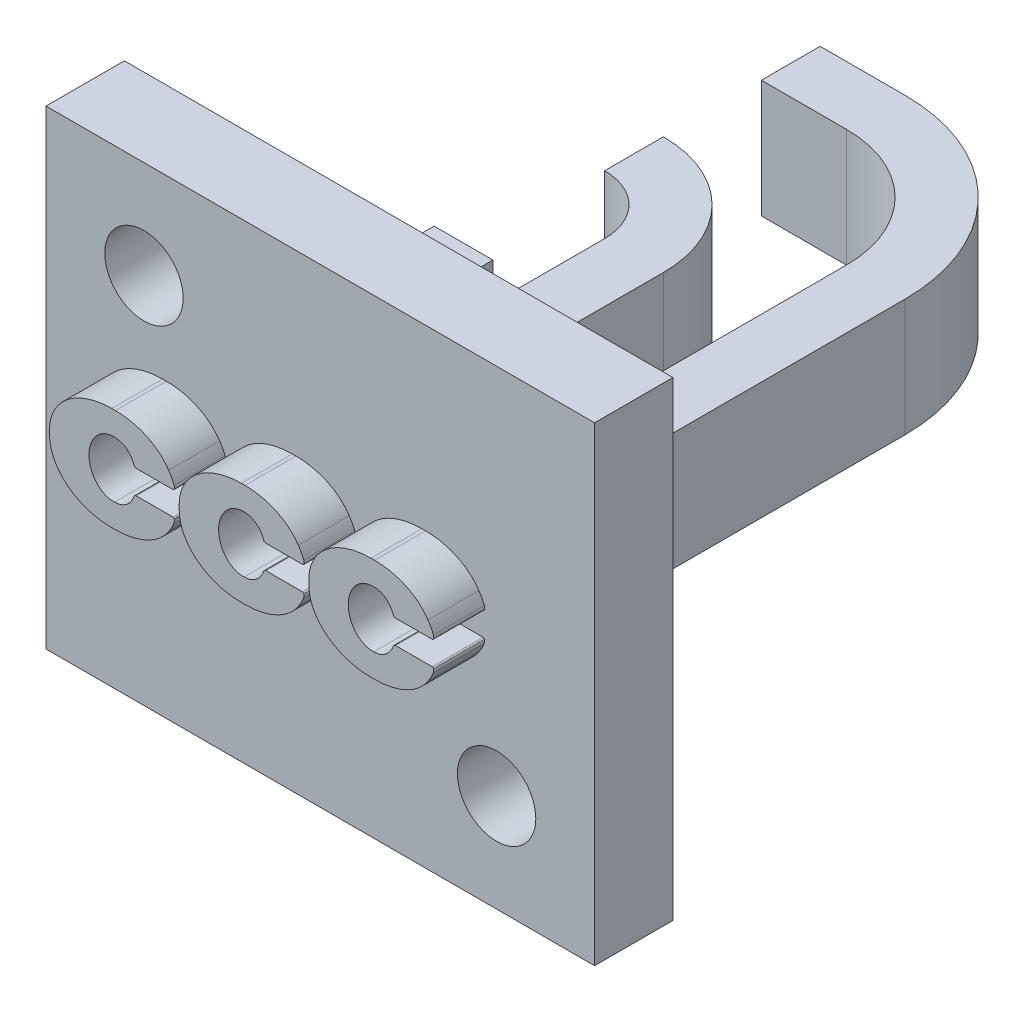
from build123d import *

# Parameters (mm, degrees)
SKETCH1_W           = 15
SKETCH1_H           = 12
BOSS_EXTRUDE1_DEPTH = 2
BOSS_EXTRUDE2_DEPTH = 2
SKETCH3_W           = 1.5
SKETCH3_H           = 4.8
BOSS_EXTRUDE3_DEPTH = 1.5
FILLET3_R           = 1.5
FILLET4_R           = 3
FILLET5_R           = 3
FILLET6_R           = 4.5
SKETCH4_W           = 2
SKETCH4_H           = 12
CUT_EXTRUDE1_DEPTH  = 1
SKETCH5_R           = 1
CUT_EXTRUDE2_DEPTH  = 17.731407672
CUT_EXTRUDE3_START  = -0.7
CUT_EXTRUDE3_DEPTH  = 0.7


with BuildPart() as part:
    # Sketch1 → Boss-Extrude1 (new body)
    with BuildSketch(Plane.XY):
        Rectangle(SKETCH1_W, SKETCH1_H)
    extrude(amount=BOSS_EXTRUDE1_DEPTH)

    # Sketch2 → Boss-Extrude2 (add)
    with BuildSketch(Plane.XY.offset(2)):
        with BuildLine():
            Line((-0.583484164, 0.443787032), (0.352350759, 0.443787032))
            ThreePointArc((0.352350759, 0.443787032), (0.370660979, 0.451874829), (0.381594807, 0.468641703))
            ThreePointArc((0.381594807, 0.468641703), (0.38478126, 0.512633483), (0.377406248, 0.556119567))
            ThreePointArc((0.377406248, 0.556119567), (0.316958398, 0.689104808), (0.240244136, 0.81341868))
            add(Edge.make_bspline(
                [(0.240244136, 0.81341868), (-0.178053426, 1.454553053), (-1.120854898, 1.454553053)],
                knots=[3.484341046, 3.484341046, 3.484341046, 4.522924348, 4.522924348, 4.522924348], degree=2, weights=[1, 0.868170926, 1]))
            Line((-1.120854898, 1.454553053), (-1.214475951, 1.454553068))
            add(Edge.make_bspline(
                [(-1.214475951, 1.454553068), (-2.800132813, 1.454553068), (-2.800132813, 0.203397992)],
                knots=[1.670440536, 1.670440536, 1.670440536, 3.203377674, 3.203377674, 3.203377674], degree=2, weights=[1, 0.720364542, 1]))
            Line((-2.800132813, 0.203397992), (-2.800132806, 0.073267738))
            add(Edge.make_bspline(
                [(-2.800132806, 0.073267738), (-2.800132806, -1.177887338), (-1.214475944, -1.177887338)],
                knots=[3.079807634, 3.079807634, 3.079807634, 4.612744771, 4.612744771, 4.612744771], degree=2, weights=[1, 0.720364542, 1]))
            Line((-1.214475944, -1.177887338), (-1.120854891, -1.177887375))
            add(Edge.make_bspline(
                [(-1.120854891, -1.177887375), (-0.178053419, -1.177887375), (0.240244143, -0.536753002)],
                knots=[1.760260959, 1.760260959, 1.760260959, 2.798844261, 2.798844261, 2.798844261], degree=2, weights=[1, 0.868170926, 1]))
            ThreePointArc((0.240244143, -0.536753002), (0.313994237, -0.417650167), (0.372658208, -0.290437354))
            ThreePointArc((0.372658208, -0.290437354), (0.384251196, -0.24211404), (0.382489087, -0.192450825))
            ThreePointArc((0.382489087, -0.192450825), (0.370484527, -0.171527836), (0.347824512, -0.163257123))
            Line((0.347824512, -0.163257123), (-0.58348421, -0.163257123))
            ThreePointArc((-0.58348421, -0.163257123), (-0.62125204, -0.175257922), (-0.645165579, -0.206858093))
            add(Edge.make_bspline(
                [(-1.141657158, -0.577741646), (-0.776549247, -0.578100851), (-0.645165579, -0.206858093)],
                knots=[5.955155363, 5.955155363, 5.955155363, 7.020735545, 7.020735545, 7.020735545], degree=2, weights=[1, 0.86139323, 1]))
            add(Edge.make_bspline(
                [(-1.201450314, 0.854894524), (-1.823540048, 0.823436889), (-1.793554178, 0.104979402), (-1.763568309, -0.613478086), (-1.141657158, -0.577741646)],
                knots=[0.039432941, 0.039432941, 0.039432941, 1.613207044, 1.613207044, 3.186981147, 3.186981147, 3.186981147], degree=2, weights=[1, 0.706053195, 1, 0.706053195, 1]))
            add(Edge.make_bspline(
                [(-0.645165584, 0.487388037), (-0.79140441, 0.900606071), (-1.201450314, 0.854894524)],
                knots=[2.404042441, 2.404042441, 2.404042441, 3.565685694, 3.565685694, 3.565685694], degree=2, weights=[1, 0.836012096, 1]))
            ThreePointArc((-0.645165584, 0.487388037), (-0.621252025, 0.455787841), (-0.583484164, 0.443787032))
        make_face()
        with BuildLine():
            Line((-3.89178871, 0.443787032), (-2.955953786, 0.443787032))
            ThreePointArc((-2.955953786, 0.443787032), (-2.937643536, 0.451874816), (-2.926709688, 0.468641703))
            ThreePointArc((-2.926709688, 0.468641703), (-2.923523234, 0.512633483), (-2.930898247, 0.556119567))
            ThreePointArc((-2.930898247, 0.556119567), (-2.991346096, 0.689104808), (-3.068060358, 0.81341868))
            add(Edge.make_bspline(
                [(-3.068060358, 0.81341868), (-3.48635792, 1.454553053), (-4.429159392, 1.454553053)],
                knots=[3.484341046, 3.484341046, 3.484341046, 4.522924348, 4.522924348, 4.522924348], degree=2, weights=[1, 0.868170926, 1]))
            Line((-4.429159392, 1.454553053), (-4.522780446, 1.454553068))
            add(Edge.make_bspline(
                [(-4.522780446, 1.454553068), (-6.108437307, 1.454553068), (-6.108437307, 0.203397992)],
                knots=[4.81203319, 4.81203319, 4.81203319, 6.344970327, 6.344970327, 6.344970327], degree=2, weights=[1, 0.720364542, 1]))
            Line((-6.108437307, 0.203397992), (-6.108437352, 0.073267738))
            add(Edge.make_bspline(
                [(-6.108437352, 0.073267738), (-6.108437352, -1.177887338), (-4.52278049, -1.177887338)],
                knots=[6.221400287, 6.221400287, 6.221400287, 7.754337425, 7.754337425, 7.754337425], degree=2, weights=[1, 0.720364542, 1]))
            Line((-4.52278049, -1.177887338), (-4.429159437, -1.177887375))
            add(Edge.make_bspline(
                [(-4.429159437, -1.177887375), (-3.486357965, -1.177887375), (-3.068060402, -0.536753002)],
                knots=[1.760260959, 1.760260959, 1.760260959, 2.798844261, 2.798844261, 2.798844261], degree=2, weights=[1, 0.868170926, 1]))
            ThreePointArc((-3.068060402, -0.536753002), (-2.994310308, -0.417650167), (-2.935646337, -0.290437354))
            ThreePointArc((-2.935646337, -0.290437354), (-2.92405335, -0.24211404), (-2.925815458, -0.192450825))
            ThreePointArc((-2.925815458, -0.192450825), (-2.937820019, -0.171527836), (-2.960480033, -0.163257123))
            Line((-2.960480033, -0.163257123), (-3.891788755, -0.163257123))
            ThreePointArc((-3.891788755, -0.163257123), (-3.929556585, -0.175257922), (-3.953470124, -0.206858093))
            add(Edge.make_bspline(
                [(-4.449961703, -0.577741646), (-4.084853792, -0.578100851), (-3.953470124, -0.206858093)],
                knots=[5.955155363, 5.955155363, 5.955155363, 7.020735545, 7.020735545, 7.020735545], degree=2, weights=[1, 0.86139323, 1]))
            add(Edge.make_bspline(
                [(-4.509754859, 0.854894524), (-5.131844593, 0.82343689), (-5.101858724, 0.104979402), (-5.071872854, -0.613478086), (-4.449961703, -0.577741646)],
                knots=[0.039432941, 0.039432941, 0.039432941, 1.613207044, 1.613207044, 3.186981147, 3.186981147, 3.186981147], degree=2, weights=[1, 0.706053195, 1, 0.706053195, 1]))
            add(Edge.make_bspline(
                [(-3.95347013, 0.487388037), (-4.099708956, 0.900606071), (-4.509754859, 0.854894524)],
                knots=[2.40404244, 2.40404244, 2.40404244, 3.565685694, 3.565685694, 3.565685694], degree=2, weights=[1, 0.836012096, 1]))
            ThreePointArc((-3.95347013, 0.487388037), (-3.92955657, 0.455787841), (-3.89178871, 0.443787032))
        make_face()
        with BuildLine():
            Line((2.724820382, 0.443787032), (3.660655305, 0.443787032))
            ThreePointArc((3.660655305, 0.443787032), (3.678965525, 0.451874829), (3.689899353, 0.468641703))
            ThreePointArc((3.689899353, 0.468641703), (3.693085806, 0.512633483), (3.685710794, 0.556119567))
            ThreePointArc((3.685710794, 0.556119567), (3.625262944, 0.689104808), (3.548548682, 0.81341868))
            add(Edge.make_bspline(
                [(3.548548682, 0.81341868), (3.13025112, 1.454553053), (2.187449648, 1.454553053)],
                knots=[0.342748392, 0.342748392, 0.342748392, 1.381331695, 1.381331695, 1.381331695], degree=2, weights=[1, 0.868170926, 1]))
            Line((2.187449648, 1.454553053), (2.093828595, 1.454553068))
            add(Edge.make_bspline(
                [(2.093828595, 1.454553068), (0.508171733, 1.454553068), (0.508171733, 0.203397992)],
                knots=[4.81203319, 4.81203319, 4.81203319, 6.344970327, 6.344970327, 6.344970327], degree=2, weights=[1, 0.720364542, 1]))
            Line((0.508171733, 0.203397992), (0.50817174, 0.073267738))
            add(Edge.make_bspline(
                [(0.50817174, 0.073267738), (0.50817174, -1.177887338), (2.093828602, -1.177887338)],
                knots=[3.079807634, 3.079807634, 3.079807634, 4.612744771, 4.612744771, 4.612744771], degree=2, weights=[1, 0.720364542, 1]))
            Line((2.093828602, -1.177887338), (2.187449655, -1.177887375))
            add(Edge.make_bspline(
                [(2.187449655, -1.177887375), (3.130251127, -1.177887375), (3.548548689, -0.536753002)],
                knots=[1.760260959, 1.760260959, 1.760260959, 2.798844261, 2.798844261, 2.798844261], degree=2, weights=[1, 0.868170926, 1]))
            ThreePointArc((3.548548689, -0.536753002), (3.622298783, -0.417650167), (3.680962754, -0.290437354))
            ThreePointArc((3.680962754, -0.290437354), (3.692555742, -0.24211404), (3.690793633, -0.192450825))
            ThreePointArc((3.690793633, -0.192450825), (3.678789073, -0.171527836), (3.656129058, -0.163257123))
            Line((3.656129058, -0.163257123), (2.724820336, -0.163257123))
            ThreePointArc((2.724820336, -0.163257123), (2.687052506, -0.175257922), (2.663138967, -0.206858093))
            add(Edge.make_bspline(
                [(2.166647388, -0.577741646), (2.531755299, -0.578100851), (2.663138967, -0.206858093)],
                knots=[5.955155363, 5.955155363, 5.955155363, 7.020735545, 7.020735545, 7.020735545], degree=2, weights=[1, 0.86139323, 1]))
            add(Edge.make_bspline(
                [(2.106854232, 0.854894524), (1.484764498, 0.823436889), (1.514750368, 0.104979402), (1.544736237, -0.613478086), (2.166647388, -0.577741646)],
                knots=[3.181025595, 3.181025595, 3.181025595, 4.754799698, 4.754799698, 6.328573801, 6.328573801, 6.328573801], degree=2, weights=[1, 0.706053195, 1, 0.706053195, 1]))
            add(Edge.make_bspline(
                [(2.663138962, 0.487388037), (2.516900136, 0.900606071), (2.106854232, 0.854894524)],
                knots=[5.545635094, 5.545635094, 5.545635094, 6.707278348, 6.707278348, 6.707278348], degree=2, weights=[1, 0.836012096, 1]))
            ThreePointArc((2.663138962, 0.487388037), (2.687052521, 0.455787841), (2.724820382, 0.443787032))
        make_face()
    extrude(amount=BOSS_EXTRUDE2_DEPTH)

    # Sketch3 → Boss-Extrude3 (add, symmetric)
    with BuildSketch(Plane(origin=(0, 0, 0), x_dir=(1, 0, 0), z_dir=(0, 1, 0))):
        Polygon((1.72873188, 0), (3.22873188, 0), (3.22873188, 13.7), (-3.442646753, 13.7), (-3.442646753, 12.2), (1.72873188, 12.2), align=None)
        with Locations((-3.644025381, 2.4)):
            Rectangle(SKETCH3_W, SKETCH3_H)
        Polygon((-1.942646753, 0), (-0.442646753, 0), (-0.442646753, 9.7), (-3.442646753, 9.7), (-3.442646753, 8.2), (-1.942646753, 8.2), align=None)
    extrude(amount=BOSS_EXTRUDE3_DEPTH, both=True)

    # Fillet3
    fillet3_edges = [part.edges().sort_by_distance(p)[0] for p in [
        (-1.942646753, 0, -8.2),
    ]]
    fillet(fillet3_edges, radius=FILLET3_R - 0.0001)  # a hair under: the kernel refuses the full size

    # Fillet4
    fillet4_edges = [part.edges().sort_by_distance(p)[0] for p in [
        (-0.442646753, 0, -9.7),
    ]]
    fillet(fillet4_edges, radius=FILLET4_R - 0.0001)  # a hair under: the kernel refuses the full size

    # Fillet5
    fillet5_edges = [part.edges().sort_by_distance(p)[0] for p in [
        (1.72873188, 0, -12.2),
    ]]
    fillet(fillet5_edges, radius=FILLET5_R)

    # Fillet6
    fillet6_edges = [part.edges().sort_by_distance(p)[0] for p in [
        (3.22873188, 0, -13.7),
    ]]
    fillet(fillet6_edges, radius=FILLET6_R)

    # Sketch4 → Cut-Extrude1 (cut)
    with BuildSketch(Plane(origin=(7.5, 0, 0), x_dir=(0, 0, -1), z_dir=(1, 0, 0))):
        with Locations((-1, 0)):
            Rectangle(SKETCH4_W, SKETCH4_H)
    extrude(amount=-CUT_EXTRUDE1_DEPTH, mode=Mode.SUBTRACT)

    # Sketch5 → Cut-Extrude2 (cut, through all)
    with BuildSketch(Plane(origin=(0, 0, 0), x_dir=(-1, 0, 0), z_dir=(0, 0, -1))):
        with Locations((-4, -3.5)):
            Circle(SKETCH5_R)
        with Locations((5, 3.5)):
            Circle(SKETCH5_R)
    extrude(amount=-CUT_EXTRUDE2_DEPTH, mode=Mode.SUBTRACT)

    # Sketch6 → Cut-Extrude3 (cut)
    with BuildSketch(Plane.XY.offset(4).offset(CUT_EXTRUDE3_START)):
        with BuildLine():
            Line((2.724820382, 0.443787032), (3.660655305, 0.443787032))
            ThreePointArc((3.660655305, 0.443787032), (3.678965525, 0.451874829), (3.689899353, 0.468641703))
            ThreePointArc((3.689899353, 0.468641703), (3.693085806, 0.512633483), (3.685710794, 0.556119567))
            ThreePointArc((3.685710794, 0.556119567), (3.625262944, 0.689104808), (3.548548682, 0.81341868))
            add(Edge.make_bspline(
                [(3.548548682, 0.81341868), (3.13025112, 1.454553053), (2.187449648, 1.454553053)],
                knots=[0.342748392, 0.342748392, 0.342748392, 1.381331695, 1.381331695, 1.381331695], degree=2, weights=[1, 0.868170926, 1]))
            Line((2.187449648, 1.454553053), (2.093828595, 1.454553068))
            add(Edge.make_bspline(
                [(2.093828595, 1.454553068), (0.508171733, 1.454553068), (0.508171733, 0.203397992)],
                knots=[4.81203319, 4.81203319, 4.81203319, 6.344970327, 6.344970327, 6.344970327], degree=2, weights=[1, 0.720364542, 1]))
            Line((0.508171733, 0.203397992), (0.50817174, 0.073267738))
            add(Edge.make_bspline(
                [(0.50817174, 0.073267738), (0.50817174, -1.177887338), (2.093828602, -1.177887338)],
                knots=[3.079807634, 3.079807634, 3.079807634, 4.612744771, 4.612744771, 4.612744771], degree=2, weights=[1, 0.720364542, 1]))
            Line((2.093828602, -1.177887338), (2.187449655, -1.177887375))
            add(Edge.make_bspline(
                [(2.187449655, -1.177887375), (3.130251127, -1.177887375), (3.548548689, -0.536753002)],
                knots=[1.760260959, 1.760260959, 1.760260959, 2.798844261, 2.798844261, 2.798844261], degree=2, weights=[1, 0.868170926, 1]))
            ThreePointArc((3.548548689, -0.536753002), (3.622298783, -0.417650167), (3.680962754, -0.290437354))
            ThreePointArc((3.680962754, -0.290437354), (3.692555742, -0.24211404), (3.690793633, -0.192450825))
            ThreePointArc((3.690793633, -0.192450825), (3.678789073, -0.171527836), (3.656129058, -0.163257123))
            Line((3.656129058, -0.163257123), (2.724820336, -0.163257123))
            ThreePointArc((2.724820336, -0.163257123), (2.687052506, -0.175257922), (2.663138967, -0.206858093))
            add(Edge.make_bspline(
                [(2.166647388, -0.577741646), (2.531755299, -0.578100851), (2.663138967, -0.206858093)],
                knots=[5.955155363, 5.955155363, 5.955155363, 7.020735545, 7.020735545, 7.020735545], degree=2, weights=[1, 0.86139323, 1]))
            add(Edge.make_bspline(
                [(2.106854232, 0.854894524), (1.484764498, 0.823436889), (1.514750368, 0.104979402), (1.544736237, -0.613478086), (2.166647388, -0.577741646)],
                knots=[3.181025595, 3.181025595, 3.181025595, 4.754799698, 4.754799698, 6.328573801, 6.328573801, 6.328573801], degree=2, weights=[1, 0.706053195, 1, 0.706053195, 1]))
            add(Edge.make_bspline(
                [(2.663138962, 0.487388037), (2.516900136, 0.900606071), (2.106854232, 0.854894524)],
                knots=[2.404042441, 2.404042441, 2.404042441, 3.565685694, 3.565685694, 3.565685694], degree=2, weights=[1, 0.836012096, 1]))
            ThreePointArc((2.663138962, 0.487388037), (2.687052521, 0.455787841), (2.724820382, 0.443787032))
        make_face()
        with BuildLine():
            Line((-0.583484164, 0.443787032), (0.352350759, 0.443787032))
            ThreePointArc((0.352350759, 0.443787032), (0.370660979, 0.451874829), (0.381594807, 0.468641703))
            ThreePointArc((0.381594807, 0.468641703), (0.38478126, 0.512633483), (0.377406248, 0.556119567))
            ThreePointArc((0.377406248, 0.556119567), (0.316958398, 0.689104808), (0.240244136, 0.81341868))
            add(Edge.make_bspline(
                [(0.240244136, 0.81341868), (-0.178053426, 1.454553053), (-1.120854898, 1.454553053)],
                knots=[0.342748392, 0.342748392, 0.342748392, 1.381331695, 1.381331695, 1.381331695], degree=2, weights=[1, 0.868170926, 1]))
            Line((-1.120854898, 1.454553053), (-1.214475951, 1.454553068))
            add(Edge.make_bspline(
                [(-1.214475951, 1.454553068), (-2.800132813, 1.454553068), (-2.800132813, 0.203397992)],
                knots=[4.81203319, 4.81203319, 4.81203319, 6.344970327, 6.344970327, 6.344970327], degree=2, weights=[1, 0.720364542, 1]))
            Line((-2.800132813, 0.203397992), (-2.800132806, 0.073267738))
            add(Edge.make_bspline(
                [(-2.800132806, 0.073267738), (-2.800132806, -1.177887338), (-1.214475944, -1.177887338)],
                knots=[3.079807634, 3.079807634, 3.079807634, 4.612744771, 4.612744771, 4.612744771], degree=2, weights=[1, 0.720364542, 1]))
            Line((-1.214475944, -1.177887338), (-1.120854891, -1.177887375))
            add(Edge.make_bspline(
                [(-1.120854891, -1.177887375), (-0.178053419, -1.177887375), (0.240244143, -0.536753002)],
                knots=[1.760260959, 1.760260959, 1.760260959, 2.798844261, 2.798844261, 2.798844261], degree=2, weights=[1, 0.868170926, 1]))
            ThreePointArc((0.240244143, -0.536753002), (0.313994237, -0.417650167), (0.372658208, -0.290437354))
            ThreePointArc((0.372658208, -0.290437354), (0.384251196, -0.24211404), (0.382489087, -0.192450825))
            ThreePointArc((0.382489087, -0.192450825), (0.370484527, -0.171527836), (0.347824512, -0.163257123))
            Line((0.347824512, -0.163257123), (-0.58348421, -0.163257123))
            ThreePointArc((-0.58348421, -0.163257123), (-0.62125204, -0.175257922), (-0.645165579, -0.206858093))
            add(Edge.make_bspline(
                [(-1.141657158, -0.577741646), (-0.776549247, -0.578100851), (-0.645165579, -0.206858093)],
                knots=[5.955155363, 5.955155363, 5.955155363, 7.020735545, 7.020735545, 7.020735545], degree=2, weights=[1, 0.86139323, 1]))
            add(Edge.make_bspline(
                [(-1.201450314, 0.854894524), (-1.823540048, 0.823436889), (-1.793554178, 0.104979402), (-1.763568309, -0.613478086), (-1.141657158, -0.577741646)],
                knots=[3.181025595, 3.181025595, 3.181025595, 4.754799698, 4.754799698, 6.328573801, 6.328573801, 6.328573801], degree=2, weights=[1, 0.706053195, 1, 0.706053195, 1]))
            add(Edge.make_bspline(
                [(-0.645165584, 0.487388037), (-0.79140441, 0.900606071), (-1.201450314, 0.854894524)],
                knots=[2.404042441, 2.404042441, 2.404042441, 3.565685694, 3.565685694, 3.565685694], degree=2, weights=[1, 0.836012096, 1]))
            ThreePointArc((-0.645165584, 0.487388037), (-0.621252025, 0.455787841), (-0.583484164, 0.443787032))
        make_face()
        with BuildLine():
            Line((-3.89178871, 0.443787032), (-2.955953786, 0.443787032))
            ThreePointArc((-2.955953786, 0.443787032), (-2.937643536, 0.451874816), (-2.926709688, 0.468641703))
            ThreePointArc((-2.926709688, 0.468641703), (-2.923523234, 0.512633483), (-2.930898247, 0.556119567))
            ThreePointArc((-2.930898247, 0.556119567), (-2.991346096, 0.689104808), (-3.068060358, 0.81341868))
            add(Edge.make_bspline(
                [(-3.068060358, 0.81341868), (-3.48635792, 1.454553053), (-4.429159392, 1.454553053)],
                knots=[0.342748392, 0.342748392, 0.342748392, 1.381331695, 1.381331695, 1.381331695], degree=2, weights=[1, 0.868170926, 1]))
            Line((-4.429159392, 1.454553053), (-4.522780446, 1.454553068))
            add(Edge.make_bspline(
                [(-4.522780446, 1.454553068), (-6.108437307, 1.454553068), (-6.108437307, 0.203397992)],
                knots=[4.81203319, 4.81203319, 4.81203319, 6.344970327, 6.344970327, 6.344970327], degree=2, weights=[1, 0.720364542, 1]))
            Line((-6.108437307, 0.203397992), (-6.108437352, 0.073267738))
            add(Edge.make_bspline(
                [(-6.108437352, 0.073267738), (-6.108437352, -1.177887338), (-4.52278049, -1.177887338)],
                knots=[3.079807634, 3.079807634, 3.079807634, 4.612744771, 4.612744771, 4.612744771], degree=2, weights=[1, 0.720364542, 1]))
            Line((-4.52278049, -1.177887338), (-4.429159437, -1.177887375))
            add(Edge.make_bspline(
                [(-4.429159437, -1.177887375), (-3.486357965, -1.177887375), (-3.068060402, -0.536753002)],
                knots=[1.760260959, 1.760260959, 1.760260959, 2.798844261, 2.798844261, 2.798844261], degree=2, weights=[1, 0.868170926, 1]))
            ThreePointArc((-3.068060402, -0.536753002), (-2.994310308, -0.417650167), (-2.935646337, -0.290437354))
            ThreePointArc((-2.935646337, -0.290437354), (-2.92405335, -0.24211404), (-2.925815458, -0.192450825))
            ThreePointArc((-2.925815458, -0.192450825), (-2.937820019, -0.171527836), (-2.960480033, -0.163257123))
            Line((-2.960480033, -0.163257123), (-3.891788755, -0.163257123))
            ThreePointArc((-3.891788755, -0.163257123), (-3.929556585, -0.175257922), (-3.953470124, -0.206858093))
            add(Edge.make_bspline(
                [(-4.449961703, -0.577741646), (-4.084853792, -0.578100851), (-3.953470124, -0.206858093)],
                knots=[5.955155363, 5.955155363, 5.955155363, 7.020735545, 7.020735545, 7.020735545], degree=2, weights=[1, 0.86139323, 1]))
            add(Edge.make_bspline(
                [(-4.509754859, 0.854894524), (-5.131844593, 0.82343689), (-5.101858724, 0.104979402), (-5.071872854, -0.613478086), (-4.449961703, -0.577741646)],
                knots=[3.181025595, 3.181025595, 3.181025595, 4.754799698, 4.754799698, 6.328573801, 6.328573801, 6.328573801], degree=2, weights=[1, 0.706053195, 1, 0.706053195, 1]))
            add(Edge.make_bspline(
                [(-3.95347013, 0.487388037), (-4.099708956, 0.900606071), (-4.509754859, 0.854894524)],
                knots=[2.40404244, 2.40404244, 2.40404244, 3.565685694, 3.565685694, 3.565685694], degree=2, weights=[1, 0.836012096, 1]))
            ThreePointArc((-3.95347013, 0.487388037), (-3.92955657, 0.455787841), (-3.89178871, 0.443787032))
        make_face()
    extrude(amount=CUT_EXTRUDE3_DEPTH, mode=Mode.SUBTRACT)


solid = part.part
